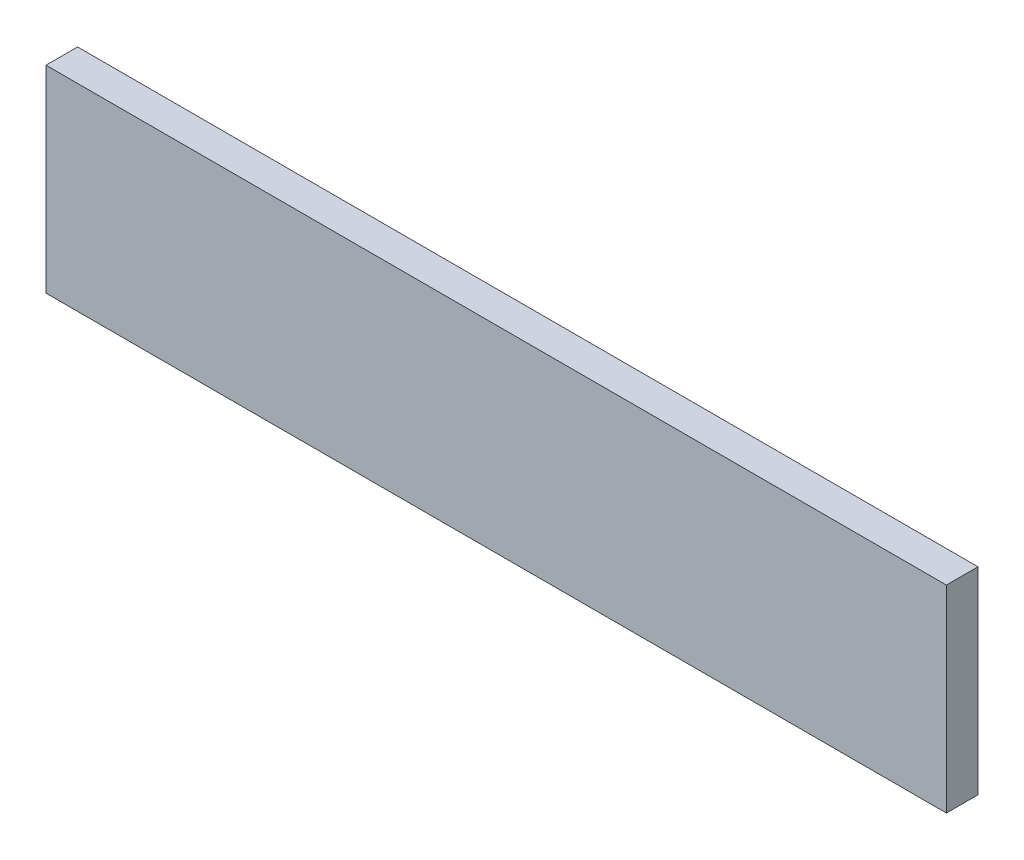
from build123d import *

# Parameters (mm, degrees)
IZIM1_W            = 1140
IZIM1_H            = 250
TABAN_FLAN_1_DEPTH = 40


# Sheet-metal steps are written as plain solids
with BuildPart() as part:
    # Çizim1 → Taban-Flanş1 (new body)
    with BuildSketch(Plane.XY):
        with Locations((570, -125)):
            Rectangle(IZIM1_W, IZIM1_H)
    extrude(amount=-TABAN_FLAN_1_DEPTH)


solid = part.part
